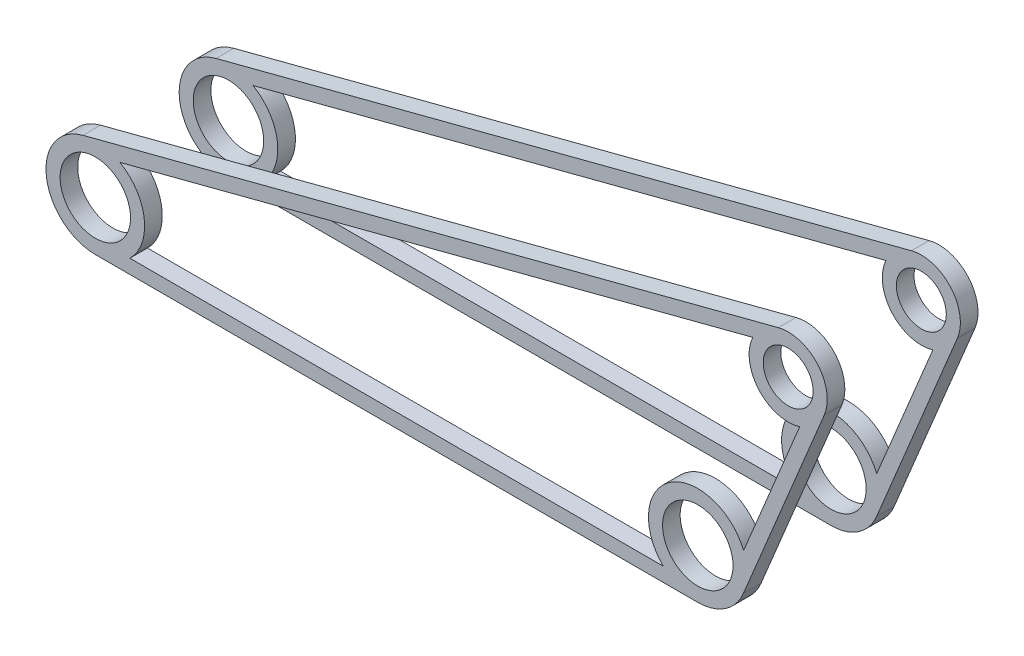
from build123d import *

# Parameters (mm, degrees)
BOSS_EXTRUDE1_START = 10.41146
SKETCH1_R           = 6.35
SKETCH1_R_2         = 4.5
BOSS_EXTRUDE1_DEPTH = 3.175
BOSS_EXTRUDE2_START = -10.41146
SKETCH1_4_R         = 6.35
SKETCH1_4_R_2       = 4.5
BOSS_EXTRUDE2_DEPTH = 3.175


with BuildPart() as part:
    # Sketch1 → Boss-Extrude1 (new body)
    with BuildSketch(Plane.XY.offset(BOSS_EXTRUDE1_START)):
        with BuildLine():
            ThreePointArc((-2.240939106, 8.602923452), (-8.817938804, -1.129626157), (0, -8.89))
            Line((0, -8.89), (108.585, -8.89))
            ThreePointArc((108.585, -8.89), (113.521814689, -7.3932375), (116.796258377, -3.406954044))
            Line((116.796258377, -3.406954044), (131.38026698, 31.742643294))
            ThreePointArc((131.38026698, 31.742643294), (130.188253202, 39.062333622), (123.103161211, 41.253277443))
            Line((123.103161211, 41.253277443), (-2.240939106, 8.602923452))
        make_face()
        Circle(SKETCH1_R, mode=Mode.SUBTRACT)
        with BuildLine():
            Line((4.420121426, 7.713275995), (118.50424059, 37.43056517))
            ThreePointArc((118.50424059, 37.43056517), (119.567273114, 29.81889368), (126.959354757, 27.715394219))
            Line((126.959354757, 27.715394219), (116.834555694, 3.31314516))
            ThreePointArc((116.834555694, 3.31314516), (103.648185311, 7.3932375), (102.363296053, -6.35))
            Line((102.363296053, -6.35), (6.221703947, -6.35))
            ThreePointArc((6.221703947, -6.35), (8.817938804, 1.129626157), (4.420121426, 7.713275995))
        make_face(mode=Mode.SUBTRACT)
        with Locations((124.877763158, 34.440613651)):
            Circle(SKETCH1_R_2, mode=Mode.SUBTRACT)
        with Locations((108.585, 0)):
            Circle(SKETCH1_R, mode=Mode.SUBTRACT)
    extrude(amount=BOSS_EXTRUDE1_DEPTH)


with BuildPart() as body_2:
    # Sketch1<4> → Boss-Extrude2 (new body)
    with BuildSketch(Plane.XY.offset(BOSS_EXTRUDE2_START)):
        with BuildLine():
            ThreePointArc((-2.240939106, 8.602923452), (-8.817938804, -1.129626157), (0, -8.89))
            Line((0, -8.89), (108.585, -8.89))
            ThreePointArc((108.585, -8.89), (113.521814689, -7.3932375), (116.796258377, -3.406954044))
            Line((116.796258377, -3.406954044), (131.38026698, 31.742643294))
            ThreePointArc((131.38026698, 31.742643294), (130.188253202, 39.062333622), (123.103161211, 41.253277443))
            Line((123.103161211, 41.253277443), (-2.240939106, 8.602923452))
        make_face()
        Circle(SKETCH1_4_R, mode=Mode.SUBTRACT)
        with BuildLine():
            Line((4.420121426, 7.713275995), (118.50424059, 37.43056517))
            ThreePointArc((118.50424059, 37.43056517), (119.567273114, 29.81889368), (126.959354757, 27.715394219))
            Line((126.959354757, 27.715394219), (116.834555694, 3.31314516))
            ThreePointArc((116.834555694, 3.31314516), (103.648185311, 7.3932375), (102.363296053, -6.35))
            Line((102.363296053, -6.35), (6.221703947, -6.35))
            ThreePointArc((6.221703947, -6.35), (8.817938804, 1.129626157), (4.420121426, 7.713275995))
        make_face(mode=Mode.SUBTRACT)
        with Locations((124.877763158, 34.440613651)):
            Circle(SKETCH1_4_R_2, mode=Mode.SUBTRACT)
        with Locations((108.585, 0)):
            Circle(SKETCH1_4_R, mode=Mode.SUBTRACT)
    extrude(amount=-BOSS_EXTRUDE2_DEPTH)


solid = Compound([part.part, body_2.part])
